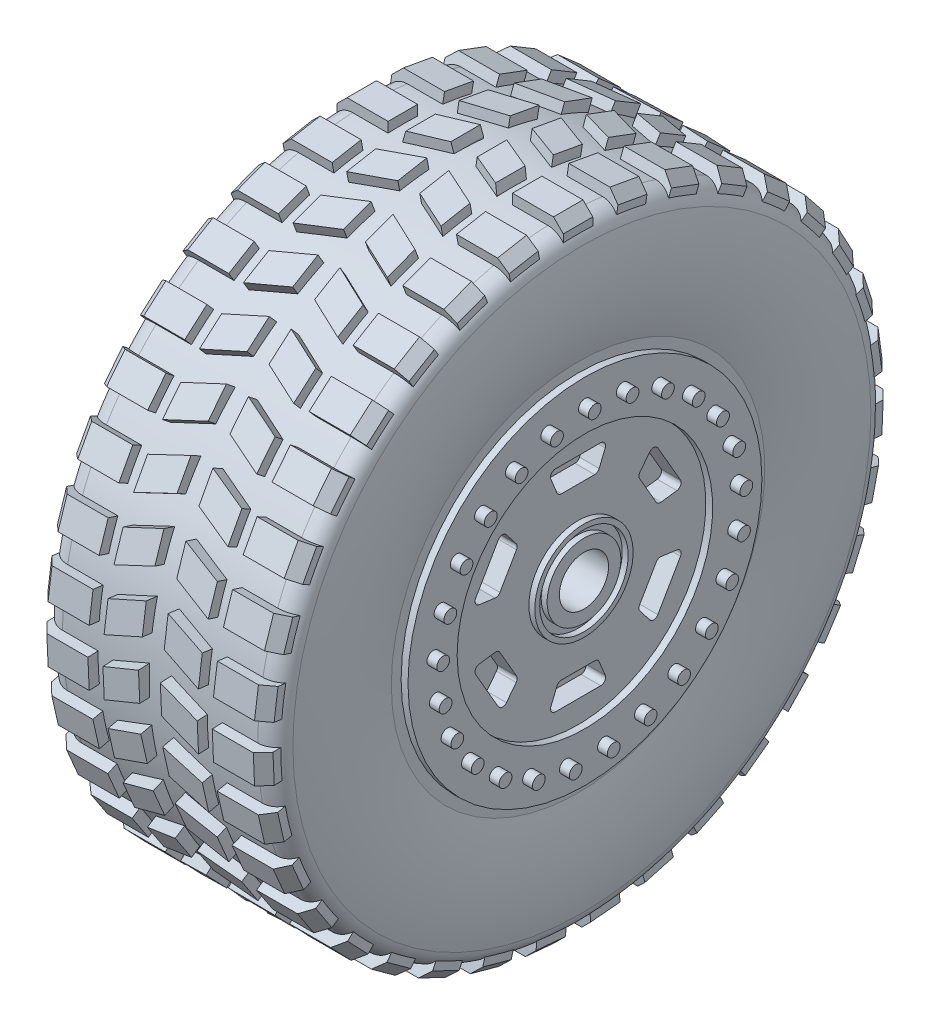
from build123d import *
from OCP.BRepFilletAPI import BRepFilletAPI_MakeChamfer

# Parameters (mm, degrees)
SKETCH2_R                    = 18
BOSS_EXTRUDE1_DEPTH          = 0.7
SKETCH3_R                    = 13
CUT_EXTRUDE1_DEPTH           = 0.7
CUT_EXTRUDE2_DEPTH           = 2
SKETCH5_R                    = 5
SKETCH5_R_2                  = 4.5
BOSS_EXTRUDE2_DEPTH          = 0.6
SKETCH6_R                    = 3.75
BOSS_EXTRUDE3_DEPTH          = 0.6
SKETCH7_R                    = 0.65
BOSS_EXTRUDE4_DEPTH          = 1
FILLET1_R                    = 2
SKETCH8_W                    = 5.176552229
SKETCH8_H                    = 3
BOSS_EXTRUDE5_DEPTH          = 1
CHAMFER1_SIZE                = 1
CIRPATTERN1_COUNT            = 35
CHAMFER1_OF_CIRPATTERN1_SIZE = 1
BOSS_EXTRUDE6_DEPTH          = 1
CHAMFER2_SIZE                = 1
CHAMFER2_SIZE_2              = 0.230868191
CIRPATTERN2_COUNT            = 35
SKETCH10_R                   = 2.5
CUT_EXTRUDE3_DEPTH           = 4


with BuildPart() as part:
    # Sketch1 → Revolve1 (revolve)
    with BuildSketch(Plane.XY, mode=Mode.PRIVATE) as revolve1_sk:
        with BuildLine():
            Line((0, 0), (0, 19))
            ThreePointArc((0, 19), (-0.831793908, 25), (0, 31))
            Line((0, 31), (11.5, 31))
            Line((11.5, 31), (11.5, 0))
            Line((11.5, 0), (0, 0))
        make_face()
    revolve(revolve1_sk.sketch.rotate(Axis((0, 0, 0), (1, 0, 0)), 90), axis=Axis((0, 0, 0), (1, 0, 0)))

    # Sketch2 → Boss-Extrude1 (add)
    with BuildSketch(Plane.ZY):
        with Locations(Location((0, 0, 0), (0, 0, 180))):
            Circle(SKETCH2_R)
    extrude(amount=BOSS_EXTRUDE1_DEPTH)

    # Sketch3 → Cut-Extrude1 (cut)
    with BuildSketch(Plane.ZY.offset(0.7)):
        Circle(SKETCH3_R)
    extrude(amount=-CUT_EXTRUDE1_DEPTH, mode=Mode.SUBTRACT)

    # Sketch4 → Cut-Extrude2 (cut)
    with BuildSketch(Plane.ZY):
        with BuildLine():
            Line((1.685739602, 8.202701859), (-1.685739602, 8.202701859))
            ThreePointArc((-1.685739602, 8.202701859), (-1.964302652, 8.287487906), (-2.148392663, 8.513091351))
            Line((-2.148392663, 8.513091351), (-2.762432376, 10.011359328))
            ThreePointArc((-2.762432376, 10.011359328), (-2.714993268, 10.479532887), (-2.299779315, 10.700969836))
            Line((-2.299779315, 10.700969836), (2.299779315, 10.700969836))
            ThreePointArc((2.299779315, 10.700969836), (2.714993268, 10.479532887), (2.762432376, 10.011359328))
            Line((2.762432376, 10.011359328), (2.148392663, 8.513091351))
            ThreePointArc((2.148392663, 8.513091351), (1.964302652, 8.287487906), (1.685739602, 8.202701859))
        make_face()
        with BuildLine():
            Line((8.117422066, 7.342152228), (10.417201381, 3.358817608))
            ThreePointArc((10.417201381, 3.358817608), (10.433038334, 2.888513302), (10.051307693, 2.61334305))
            Line((10.051307693, 2.61334305), (8.446749706, 2.395983052))
            ThreePointArc((8.446749706, 2.395983052), (8.159326386, 2.442607955), (7.946617991, 2.64145761))
            Line((7.946617991, 2.64145761), (6.260878389, 5.561244249))
            ThreePointArc((6.260878389, 5.561244249), (6.195023734, 5.84487995), (6.298357043, 6.117108299))
            Line((6.298357043, 6.117108299), (7.288875316, 7.398016278))
            ThreePointArc((7.288875316, 7.398016278), (7.718045065, 7.591019585), (8.117422066, 7.342152228))
        make_face()
        with BuildLine():
            Line((10.417201381, -3.358817608), (8.117422066, -7.342152228))
            ThreePointArc((8.117422066, -7.342152228), (7.718045065, -7.591019585), (7.288875316, -7.398016278))
            Line((7.288875316, -7.398016278), (6.298357043, -6.117108299))
            ThreePointArc((6.298357043, -6.117108299), (6.195023734, -5.84487995), (6.260878389, -5.561244249))
            Line((6.260878389, -5.561244249), (7.946617991, -2.64145761))
            ThreePointArc((7.946617991, -2.64145761), (8.159326386, -2.442607955), (8.446749706, -2.395983052))
            Line((8.446749706, -2.395983052), (10.051307693, -2.61334305))
            ThreePointArc((10.051307693, -2.61334305), (10.433038334, -2.888513302), (10.417201381, -3.358817608))
        make_face()
        with BuildLine():
            Line((2.299779315, -10.700969836), (-2.299779315, -10.700969836))
            ThreePointArc((-2.299779315, -10.700969836), (-2.714993268, -10.479532887), (-2.762432376, -10.011359328))
            Line((-2.762432376, -10.011359328), (-2.148392663, -8.513091351))
            ThreePointArc((-2.148392663, -8.513091351), (-1.964302652, -8.287487906), (-1.685739602, -8.202701859))
            Line((-1.685739602, -8.202701859), (1.685739602, -8.202701859))
            ThreePointArc((1.685739602, -8.202701859), (1.964302652, -8.287487906), (2.148392663, -8.513091351))
            Line((2.148392663, -8.513091351), (2.762432376, -10.011359328))
            ThreePointArc((2.762432376, -10.011359328), (2.714993268, -10.479532887), (2.299779315, -10.700969836))
        make_face()
        with BuildLine():
            Line((-8.117422066, -7.342152228), (-10.417201381, -3.358817608))
            ThreePointArc((-10.417201381, -3.358817608), (-10.433038334, -2.888513302), (-10.051307693, -2.61334305))
            Line((-10.051307693, -2.61334305), (-8.446749706, -2.395983052))
            ThreePointArc((-8.446749706, -2.395983052), (-8.159326386, -2.442607955), (-7.946617991, -2.64145761))
            Line((-7.946617991, -2.64145761), (-6.260878389, -5.561244249))
            ThreePointArc((-6.260878389, -5.561244249), (-6.195023734, -5.84487995), (-6.298357043, -6.117108299))
            Line((-6.298357043, -6.117108299), (-7.288875316, -7.398016278))
            ThreePointArc((-7.288875316, -7.398016278), (-7.718045065, -7.591019585), (-8.117422066, -7.342152228))
        make_face()
        with BuildLine():
            Line((-10.417201381, 3.358817608), (-8.117422066, 7.342152228))
            ThreePointArc((-8.117422066, 7.342152228), (-7.718045065, 7.591019585), (-7.288875316, 7.398016278))
            Line((-7.288875316, 7.398016278), (-6.298357043, 6.117108299))
            ThreePointArc((-6.298357043, 6.117108299), (-6.195023734, 5.84487995), (-6.260878389, 5.561244249))
            Line((-6.260878389, 5.561244249), (-7.946617991, 2.64145761))
            ThreePointArc((-7.946617991, 2.64145761), (-8.159326386, 2.442607955), (-8.446749706, 2.395983052))
            Line((-8.446749706, 2.395983052), (-10.051307693, 2.61334305))
            ThreePointArc((-10.051307693, 2.61334305), (-10.433038334, 2.888513302), (-10.417201381, 3.358817608))
        make_face()
    extrude(amount=-CUT_EXTRUDE2_DEPTH, mode=Mode.SUBTRACT)

    # Sketch5 → Boss-Extrude2 (add)
    with BuildSketch(Plane.ZY):
        Circle(SKETCH5_R)
        Circle(SKETCH5_R_2, mode=Mode.SUBTRACT)
    extrude(amount=BOSS_EXTRUDE2_DEPTH)

    # Sketch6 → Boss-Extrude3 (add)
    with BuildSketch(Plane.ZY):
        Circle(SKETCH6_R)
    extrude(amount=BOSS_EXTRUDE3_DEPTH)

    # Sketch7 → Boss-Extrude4 (add)
    with BuildSketch(Plane.ZY.offset(0.7)):
        with Locations((0, 15.448599141)):
            Circle(SKETCH7_R)
        with Locations((3.841910377, 14.963252991)):
            Circle(SKETCH7_R)
        with Locations((7.442419396, 13.537710624)):
            Circle(SKETCH7_R)
        with Locations((10.575293832, 11.261544111)):
            Circle(SKETCH7_R)
        with Locations((13.043683664, 8.277773364)):
            Circle(SKETCH7_R)
        with Locations((14.69249088, 4.773879674)):
            Circle(SKETCH7_R)
        with Locations((15.418114859, 0.970025566)):
            Circle(SKETCH7_R)
        with Locations((15.174961977, -2.894778815)):
            Circle(SKETCH7_R)
        with Locations((13.978310425, -6.577693598)):
            Circle(SKETCH7_R)
        with Locations((11.90335022, -9.8473077)):
            Circle(SKETCH7_R)
        with Locations((9.080458743, -12.498179244)):
            Circle(SKETCH7_R)
        with Locations((5.687008648, -14.363744221)):
            Circle(SKETCH7_R)
        with Locations((1.936222884, -15.326782322)):
            Circle(SKETCH7_R)
        with Locations((-1.936222884, -15.326782322)):
            Circle(SKETCH7_R)
        with Locations((-5.687008648, -14.363744221)):
            Circle(SKETCH7_R)
        with Locations((-9.080458743, -12.498179244)):
            Circle(SKETCH7_R)
        with Locations((-11.90335022, -9.8473077)):
            Circle(SKETCH7_R)
        with Locations((-13.978310425, -6.577693598)):
            Circle(SKETCH7_R)
        with Locations((-15.174961977, -2.894778815)):
            Circle(SKETCH7_R)
        with Locations((-15.418114859, 0.970025566)):
            Circle(SKETCH7_R)
        with Locations((-14.69249088, 4.773879674)):
            Circle(SKETCH7_R)
        with Locations((-13.043683664, 8.277773364)):
            Circle(SKETCH7_R)
        with Locations((-10.575293832, 11.261544111)):
            Circle(SKETCH7_R)
        with Locations((-7.442419396, 13.537710624)):
            Circle(SKETCH7_R)
        with Locations((-3.841910377, 14.963252991)):
            Circle(SKETCH7_R)
    extrude(amount=BOSS_EXTRUDE4_DEPTH)

    # Fillet1
    fillet1_edges = [part.edges().sort_by_distance(p)[0] for p in [
        (0, 0, -31),
    ]]
    fillet(fillet1_edges, radius=FILLET1_R)

    # Sketch8 → Boss-Extrude5 (add, symmetric)
    with BuildSketch(Plane(origin=(0, 31, 0), x_dir=(1, 0, 0), z_dir=(0, 1, 0))):
        with Locations((2.588276115, 0)):
            Rectangle(SKETCH8_W, SKETCH8_H)
    boss_extrude5 = extrude(amount=BOSS_EXTRUDE5_DEPTH, both=True)

    # Chamfer1
    chamfer1_edges = [part.edges().sort_by_distance(p)[0] for p in [
        (0, 32, 0),
    ]]
    chamfer(chamfer1_edges, length=CHAMFER1_SIZE)

    # CirPattern1: Boss-Extrude5 ×35 about axis
    cirpattern1_axis = Axis((0, 0, 0), (1, 0, 0))
    for i in range(1, CIRPATTERN1_COUNT):
        add(boss_extrude5.rotate(cirpattern1_axis, i * 360 / CIRPATTERN1_COUNT))

    # Chamfer1 of CirPattern1
    chamfer1_of_cirpattern1_edges = [part.edges().sort_by_distance(p)[0] for p in [
        (0, 31.485746835, 5.713820634),
        (0, 29.95951586, 11.243994371),
        (0, 27.470361395, 16.412776877),
        (0, 24.098286912, 21.05403923),
        (0, 19.951673659, 25.018607439),
        (0, 15.163797199, 28.179057019),
        (0, 9.88854382, 30.433808521),
        (0, 4.295464506, 31.710392377),
        (0, -1.435674571, 31.967778129),
        (0, -7.120669887, 31.19769319),
        (0, -12.576801013, 29.424888722),
        (0, -17.628703406, 26.706344119),
        (0, -22.114004768, 23.129435642),
        (0, -25.88854382, 18.809128073),
        (0, -28.831003773, 13.884279652),
        (0, -30.846811542, 8.513179058),
        (0, -31.871177408, 2.868457885),
        (0, -31.871177408, -2.868457885),
        (0, -30.846811542, -8.513179058),
        (0, -28.831003773, -13.884279652),
        (0, -25.88854382, -18.809128073),
        (0, -22.114004768, -23.129435642),
        (0, -17.628703406, -26.706344119),
        (0, -12.576801013, -29.424888722),
        (0, -7.120669887, -31.19769319),
        (0, -1.435674571, -31.967778129),
        (0, 4.295464506, -31.710392377),
        (0, 9.88854382, -30.433808521),
        (0, 15.163797199, -28.179057019),
        (0, 19.951673659, -25.018607439),
        (0, 24.098286912, -21.05403923),
        (0, 27.470361395, -16.412776877),
        (0, 29.95951586, -11.243994371),
        (0, 31.485746835, -5.713820634),
    ]]
    chamfer(chamfer1_of_cirpattern1_edges, length=CHAMFER1_OF_CIRPATTERN1_SIZE)

    # Sketch9 → Boss-Extrude6 (add, symmetric)
    with BuildSketch(Plane(origin=(0, 31, 0), x_dir=(1, 0, 0), z_dir=(0, 1, 0))):
        Polygon((6.704747619, -1.549141166), (10.387615022, 0), (10.387615022, 3), (6.704747619, 1.450858834), align=None)
    boss_extrude6 = extrude(amount=BOSS_EXTRUDE6_DEPTH, both=True)

    # Chamfer2
    chamfer2_edges_1 = [part.edges().sort_by_distance(p)[0] for p in [
        (10.387615022, 32, -1.5),
    ]]
    chamfer2_side_1 = [part.faces().sort_by_distance(p)[0] for p in [
        (10.387615022, 31.995382636, -1.5),
    ]]
    chamfer2_edges_2 = [part.edges().sort_by_distance(p)[0] for p in [
        (6.704747619, 32, 0.049141166),
    ]]
    chamfer2_side_2 = [part.faces().sort_by_distance(p)[0] for p in [
        (6.704747619, 31.995382636, 0.049141166),
    ]]
    chamfer2 = BRepFilletAPI_MakeChamfer(part.part.solid().wrapped)
    for e in chamfer2_edges_1:
        chamfer2.Add(CHAMFER2_SIZE - 0.0001, CHAMFER2_SIZE_2 - 0.0001, e.wrapped, chamfer2_side_1[0].wrapped)
    for e in chamfer2_edges_2:
        chamfer2.Add(CHAMFER2_SIZE - 0.0001, CHAMFER2_SIZE_2 - 0.0001, e.wrapped, chamfer2_side_2[0].wrapped)
    add(Compound.cast(chamfer2.Shape()), mode=Mode.REPLACE)  # a hair under: the kernel refuses the full size

    # CirPattern2: Boss-Extrude6 ×35 about axis
    cirpattern2_axis = Axis((0, 0, 0), (1, 0, 0))
    for i in range(1, CIRPATTERN2_COUNT):
        add(boss_extrude6.rotate(cirpattern2_axis, i * 360 / CIRPATTERN2_COUNT))

    # Mirror1: part across plane


with BuildPart() as part_1:
    add(part.part)
    add(part.part.mirror(Plane(origin=(11.5, 31, 0), x_dir=(0, 0, 1), z_dir=(-1, 0, 0))))

    # Sketch10 → Cut-Extrude3 (cut)
    with BuildSketch(Plane(origin=(23.6, 0, 0), x_dir=(0, 0, -1), z_dir=(1, 0, 0))):
        Circle(SKETCH10_R)
    extrude(amount=-CUT_EXTRUDE3_DEPTH, mode=Mode.SUBTRACT)


solid = part_1.part
